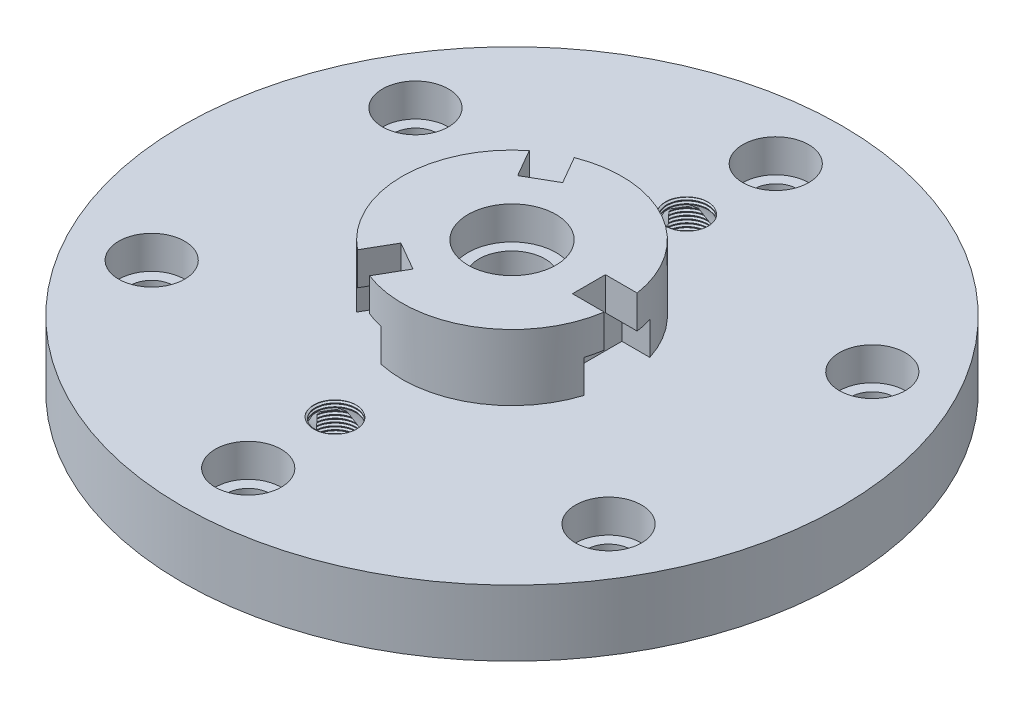
from build123d import *

# Parameters (mm, degrees)
SKETCH2_R                               = 50
BOSS_EXTRUDE1_DEPTH                     = 30
CBORE_FOR_M5_HEX_HEAD_BOLT1_D           = 30
CBORE_FOR_M5_HEX_HEAD_BOLT1_CBORE_D     = 40
CBORE_FOR_M5_HEX_HEAD_BOLT1_CBORE_DEPTH = 15
CBORE_FOR_M5_HEX_HEAD_BOLT2_D           = 20
CBORE_FOR_M5_HEX_HEAD_BOLT2_CBORE_D     = 30
CBORE_FOR_M5_HEX_HEAD_BOLT2_CBORE_DEPTH = 15
CIRPATTERN1_COUNT                       = 6
SKETCH12_W                              = 57.37201598
SKETCH12_H                              = 30
CUT_EXTRUDE3_DEPTH                      = 15
SKETCH13_W                              = 60.861025455
SKETCH13_H                              = 15
CUT_EXTRUDE4_DEPTH                      = 15
CIRPATTERN2_COUNT                       = 3
CIRPATTERN4_COUNT                       = 3
CUT_EXTRUDE5_DEPTH                      = 15
TAP_DRILL_FOR_M20X1_5_TAP1_D            = 18.5
THREAD1_PITCH                           = 1.5
THREAD2_PITCH                           = 1.5


with BuildPart() as part:
    # Sketch1 → Revolve1 (revolve)
    with BuildSketch(Plane.XY, mode=Mode.PRIVATE) as revolve1_sk:
        Polygon((0, 0), (30, 0), (30, 50), (60, 50), (60, 70), (150, 70), (150, 100), (0, 100), align=None)
    revolve(revolve1_sk.sketch.rotate(Axis((0, 100, 0), (0, -1, 0)), 180), axis=Axis((0, 100, 0), (0, -1, 0)))

    # Sketch2 → Boss-Extrude1 (add)
    with BuildSketch(Plane(origin=(0, 100, 0), x_dir=(1, 0, 0), z_dir=(0, 1, 0))):
        with Locations(Location((0, 0, 0), (0, 0, 180))):
            Circle(SKETCH2_R)
    extrude(amount=BOSS_EXTRUDE1_DEPTH)

    # CBORE for M5 Hex Head Bolt1 (through all)
    with Locations(Plane(origin=(0, 130, 0), x_dir=(1, 0, 0), z_dir=(0, 1, 0))):
        with Locations((0, 0)):
            CounterBoreHole(CBORE_FOR_M5_HEX_HEAD_BOLT1_D / 2, CBORE_FOR_M5_HEX_HEAD_BOLT1_CBORE_D / 2, CBORE_FOR_M5_HEX_HEAD_BOLT1_CBORE_DEPTH)

    # CBORE for M5 Hex Head Bolt2 (through all)
    with Locations(Plane(origin=(0, 100, 0), x_dir=(1, 0, 0), z_dir=(0, 1, 0))):
        with Locations((0, 120)):
            cbore_for_m5_hex_head_bolt2 = CounterBoreHole(CBORE_FOR_M5_HEX_HEAD_BOLT2_D / 2, CBORE_FOR_M5_HEX_HEAD_BOLT2_CBORE_D / 2, CBORE_FOR_M5_HEX_HEAD_BOLT2_CBORE_DEPTH)

    # CirPattern1: CBORE for M5 Hex Head Bolt2 ×6 about axis
    cirpattern1_axis = Axis((0, 0, 0), (0, 1, 0))
    for i in range(1, CIRPATTERN1_COUNT):
        add(cbore_for_m5_hex_head_bolt2.rotate(cirpattern1_axis, i * 360 / CIRPATTERN1_COUNT), mode=Mode.SUBTRACT)

    # Sketch12 → Cut-Extrude3 (cut)
    with BuildSketch(Plane(origin=(0, 100, 0), x_dir=(1, 0, 0), z_dir=(0, 1, 0))):
        with Locations((63.68600799, 0)):
            Rectangle(SKETCH12_W, SKETCH12_H)
    cut_extrude3 = extrude(amount=CUT_EXTRUDE3_DEPTH, mode=Mode.SUBTRACT)

    # Sketch13 → Cut-Extrude4 (cut)
    with BuildSketch(Plane(origin=(0, 130, 0), x_dir=(1, 0, 0), z_dir=(0, 1, 0))):
        with Locations((65.430512728, 0)):
            Rectangle(SKETCH13_W, SKETCH13_H)
    cut_extrude4 = extrude(amount=-CUT_EXTRUDE4_DEPTH, mode=Mode.SUBTRACT)

    # CirPattern2: Cut-Extrude3 ×3 about axis
    cirpattern2_axis = Axis((0, 0, 0), (0, 1, 0))
    for i in range(1, CIRPATTERN2_COUNT):
        add(cut_extrude3.rotate(cirpattern2_axis, i * 360 / CIRPATTERN2_COUNT), mode=Mode.SUBTRACT)

    # CirPattern4: Cut-Extrude4 ×3 about axis
    cirpattern4_axis = Axis((0, 0, 0), (0, 1, 0))
    for i in range(1, CIRPATTERN4_COUNT):
        add(cut_extrude4.rotate(cirpattern4_axis, i * 360 / CIRPATTERN4_COUNT), mode=Mode.SUBTRACT)

    # Sketch15 → Cut-Extrude5 (cut)
    with BuildSketch(Plane(origin=(35, 0, 0), x_dir=(0, 0, -1), z_dir=(1, 0, 0))):
        with BuildLine():
            Line((8, 30), (8, -36.530556128))
            ThreePointArc((8, -36.530556128), (0, -44.530556128), (-8, -36.530556128))
            Line((-8, -36.530556128), (-8, 30))
            ThreePointArc((-8, 30), (0, 38), (8, 30))
        make_face()
    cut_extrude5 = extrude(amount=-CUT_EXTRUDE5_DEPTH, mode=Mode.SUBTRACT)

    # Mirror1: Cut-Extrude5 across plane
    add(cut_extrude5.mirror(Plane(origin=(0, 0, 0), x_dir=(0, 0, 1), z_dir=(1, 0, 0))), mode=Mode.SUBTRACT)

    # Tap Drill for M20x1.5 Tap1 (through all)
    with Locations(Plane(origin=(0, 130, 0), x_dir=(1, 0, 0), z_dir=(0, 1, 0))):
        with Locations((0, 80), (0, -80)):
            Hole(TAP_DRILL_FOR_M20X1_5_TAP1_D / 2)

    # Thread1: arcs per turn and ends read off the stored shape
    # Thread1: the profile of Thread Profile1 profile screwed along a right-hand helix through 26.666667 turns, 8 arcs to a turn; built about Z, then put on its axis
    thread1_z = Axis((0, 0, 0), (0, 0, 1))
    thread1_corners = [(9.2497, 0, -0.000173205), (10.061898812, 0, 0.468749998), (10.061898812, 0, 0.656249998), (9.2497, 0, 1.125173201)]
    with BuildLine(mode=Mode.PRIVATE) as thread1_profile:
        Line(thread1_corners[0], thread1_corners[1])
        Line(thread1_corners[1], thread1_corners[2])
        Line(thread1_corners[2], thread1_corners[3])
        Line(thread1_corners[3], thread1_corners[0])
    thread1_cap = Face(thread1_profile.wire())
    thread1_turn_angles = [0, 22.5, 45, 67.5, 90, 112.5, 135, 157.5, 180, 202.5, 225, 247.5, 270, 292.5, 315, 337.5, 360]
    thread1_turn_weights = [1, 0.9238795325112867, 1, 0.9238795325112867, 1, 0.9238795325112867, 1, 0.9238795325112867, 1, 0.9238795325112867, 1, 0.9238795325112867, 1, 0.9238795325112867, 1, 0.9238795325112867, 1]
    thread1_turn_rails = [Edge.make_bspline([Vector(p[0], p[1], 0).rotate(thread1_z, thread1_turn_angles[k]) / thread1_turn_weights[k] + Vector(0, 0, p[2] + THREAD1_PITCH * thread1_turn_angles[k] / 360) for k in range(17)], [0, 0, 0, 1, 1, 2, 2, 3, 3, 4, 4, 5, 5, 6, 6, 7, 7, 8, 8, 8], 2, thread1_turn_weights) for p in thread1_corners]
    thread1_turn_sides = [Face.make_surface_from_curves(thread1_turn_rails[p[0]], thread1_turn_rails[p[1]]) for p in [(0, 1), (1, 2), (2, 3), (3, 0)]]
    thread1_last_angles = [9360, 9382.5, 9405, 9427.5, 9450, 9472.5, 9495, 9517.5, 9540, 9562.5, 9585, 9592.5, 9600]
    thread1_last_weights = [1, 0.9238795325112867, 1, 0.9238795325112867, 1, 0.9238795325112867, 1, 0.9238795325112867, 1, 0.9238795325112867, 1, 0.9914448613738125, 1]
    thread1_last_rails = [Edge.make_bspline([Vector(p[0], p[1], 0).rotate(thread1_z, thread1_last_angles[k]) / thread1_last_weights[k] + Vector(0, 0, p[2] + THREAD1_PITCH * thread1_last_angles[k] / 360) for k in range(13)], [0, 0, 0, 1, 1, 2, 2, 3, 3, 4, 4, 5, 5, 6, 6, 6], 2, thread1_last_weights) for p in thread1_corners]
    thread1_last_sides = [Face.make_surface_from_curves(thread1_last_rails[p[0]], thread1_last_rails[p[1]]) for p in [(0, 1), (1, 2), (2, 3), (3, 0)]]
    thread1 = Plane(origin=(0, 102, 80), x_dir=(-1, 0, 0), z_dir=(0, -1, 0)) * Solid(Shell([*[p.moved(Location((0, 0, THREAD1_PITCH * i))) for i in range(26) for p in thread1_turn_sides], *thread1_last_sides, thread1_cap, thread1_cap.rotate(thread1_z, 9600).moved(Location((0, 0, THREAD1_PITCH * 9600 / 360)))]))
    add(thread1, mode=Mode.SUBTRACT)

    # Thread2: arcs per turn and ends read off the stored shape
    # Thread2: the profile of Thread Profile2 profile screwed along a right-hand helix through 26.666667 turns, 8 arcs to a turn; built about Z, then put on its axis
    thread2_z = Axis((0, 0, 0), (0, 0, 1))
    thread2_corners = [(9.2497, 0, -0.000173205), (10.061898812, 0, 0.468749998), (10.061898812, 0, 0.656249998), (9.2497, 0, 1.125173201)]
    with BuildLine(mode=Mode.PRIVATE) as thread2_profile:
        Line(thread2_corners[0], thread2_corners[1])
        Line(thread2_corners[1], thread2_corners[2])
        Line(thread2_corners[2], thread2_corners[3])
        Line(thread2_corners[3], thread2_corners[0])
    thread2_cap = Face(thread2_profile.wire())
    thread2_turn_angles = [0, 22.5, 45, 67.5, 90, 112.5, 135, 157.5, 180, 202.5, 225, 247.5, 270, 292.5, 315, 337.5, 360]
    thread2_turn_weights = [1, 0.9238795325112867, 1, 0.9238795325112867, 1, 0.9238795325112867, 1, 0.9238795325112867, 1, 0.9238795325112867, 1, 0.9238795325112867, 1, 0.9238795325112867, 1, 0.9238795325112867, 1]
    thread2_turn_rails = [Edge.make_bspline([Vector(p[0], p[1], 0).rotate(thread2_z, thread2_turn_angles[k]) / thread2_turn_weights[k] + Vector(0, 0, p[2] + THREAD2_PITCH * thread2_turn_angles[k] / 360) for k in range(17)], [0, 0, 0, 1, 1, 2, 2, 3, 3, 4, 4, 5, 5, 6, 6, 7, 7, 8, 8, 8], 2, thread2_turn_weights) for p in thread2_corners]
    thread2_turn_sides = [Face.make_surface_from_curves(thread2_turn_rails[p[0]], thread2_turn_rails[p[1]]) for p in [(0, 1), (1, 2), (2, 3), (3, 0)]]
    thread2_last_angles = [9360, 9382.5, 9405, 9427.5, 9450, 9472.5, 9495, 9517.5, 9540, 9562.5, 9585, 9592.5, 9600]
    thread2_last_weights = [1, 0.9238795325112867, 1, 0.9238795325112867, 1, 0.9238795325112867, 1, 0.9238795325112867, 1, 0.9238795325112867, 1, 0.9914448613738125, 1]
    thread2_last_rails = [Edge.make_bspline([Vector(p[0], p[1], 0).rotate(thread2_z, thread2_last_angles[k]) / thread2_last_weights[k] + Vector(0, 0, p[2] + THREAD2_PITCH * thread2_last_angles[k] / 360) for k in range(13)], [0, 0, 0, 1, 1, 2, 2, 3, 3, 4, 4, 5, 5, 6, 6, 6], 2, thread2_last_weights) for p in thread2_corners]
    thread2_last_sides = [Face.make_surface_from_curves(thread2_last_rails[p[0]], thread2_last_rails[p[1]]) for p in [(0, 1), (1, 2), (2, 3), (3, 0)]]
    thread2 = Plane(origin=(0, 102, -80), x_dir=(-1, 0, 0), z_dir=(0, -1, 0)) * Solid(Shell([*[p.moved(Location((0, 0, THREAD2_PITCH * i))) for i in range(26) for p in thread2_turn_sides], *thread2_last_sides, thread2_cap, thread2_cap.rotate(thread2_z, 9600).moved(Location((0, 0, THREAD2_PITCH * 9600 / 360)))]))
    add(thread2, mode=Mode.SUBTRACT)


solid = part.part
